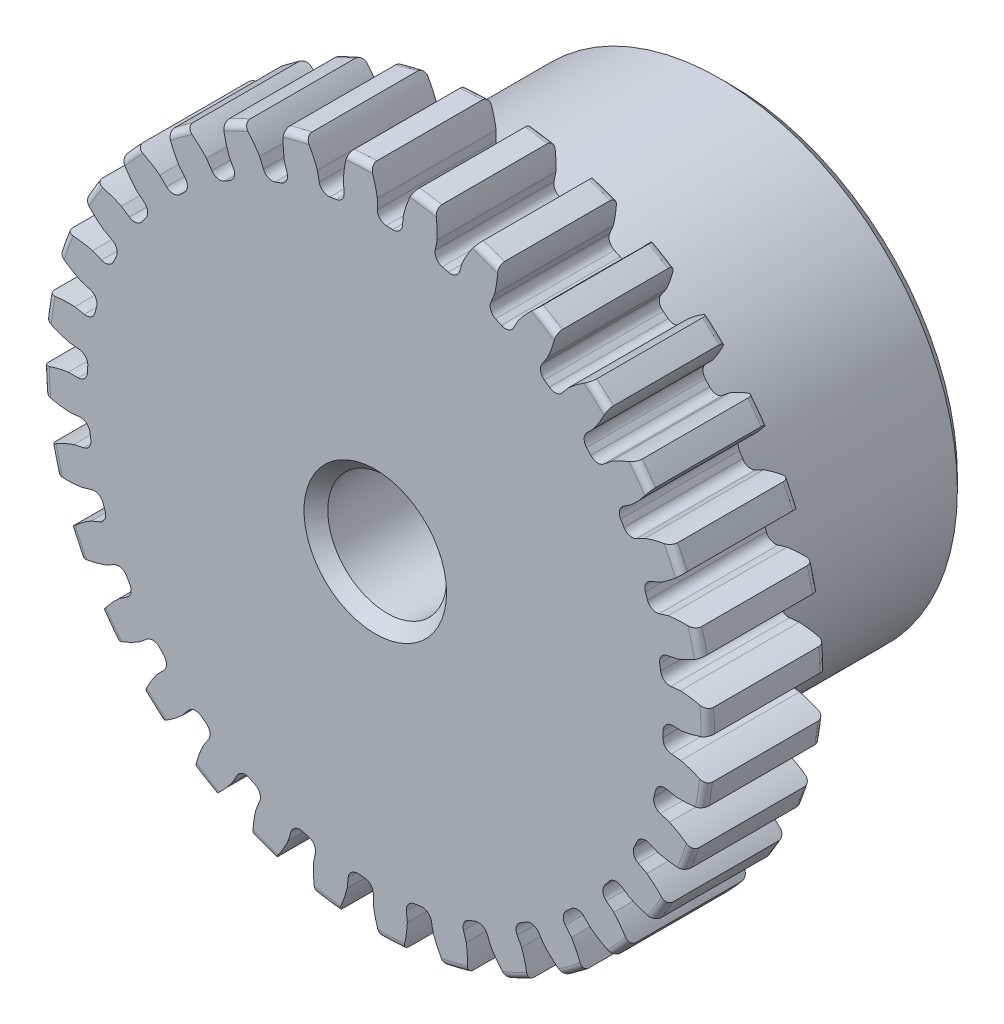
from build123d import *

# Parameters (mm, degrees)
SKETCH1_R                = 8.89
BOSS_EXTRUDE1_DEPTH      = 3.175
SKETCH2_W                = 6.35
SKETCH2_H                = 6.35
FILLET2_R                = 0.1778
CUT_EXTRUDE1_DEPTH       = 16.773072839
FILLET1_R                = 0.249489182
CIRPATTERN1_COUNT        = 32
FILLET1_OF_CIRPATTERN1_R = 0.249489182
SKETCH5_R                = 1.5875
CUT_EXTRUDE2_DEPTH       = 16.771905356
CHAMFER1_SIZE            = 0.3175


with BuildPart() as part:
    # Sketch1 → Boss-Extrude1 (new body)
    with BuildSketch(Plane.XY):
        Circle(SKETCH1_R)
    extrude(amount=-BOSS_EXTRUDE1_DEPTH)

    # Sketch2 → Revolve1 (revolve)
    with BuildSketch(Plane(origin=(0, 0, 0), x_dir=(0, 0, -1), z_dir=(1, 0, 0))):
        with Locations((6.35, 3.175)):
            Rectangle(SKETCH2_W, SKETCH2_H)
    revolve(axis=Axis((0, 0, -3.175), (0, 0, -1)))

    # Fillet2
    fillet2_edges = [part.edges().sort_by_distance(p)[0] for p in [
        (-8.89, 0, -3.175),
        (-8.89, 0, 0),
        (0, -6.35, -3.175),
    ]]
    fillet(fillet2_edges, radius=FILLET2_R)

    # Sketch4 → Cut-Extrude1 (cut, through all)
    with BuildSketch(Plane.XY):
        with BuildLine():
            Line((0.053138783, 8.200909689), (0.053138783, 7.698596297))
            ThreePointArc((0.053138783, 7.698596297), (0.377762097, 7.689506127), (0.701713249, 7.666733802))
            Line((0.701713249, 7.666733802), (0.750948686, 8.166628407))
            add(Edge.make_bspline(
                [(1.821754445, 9.820491389), (0.994167126, 9.128663497), (0.750948686, 8.166628407)],
                knots=[0, 0, 0, 1, 1, 1], degree=2))
            ThreePointArc((1.821754445, 9.820491389), (0.490090787, 9.976003779), (-0.850403432, 9.951766395))
            add(Edge.make_bspline(
                [(-0.850403432, 9.951766395), (-0.09461234, 9.182151928), (0.053138783, 8.200909689)],
                knots=[0, 0, 0, 1, 1, 1], degree=2))
        make_face()
    cut_extrude1 = extrude(amount=-CUT_EXTRUDE1_DEPTH, mode=Mode.SUBTRACT)

    # Fillet1
    fillet1_edges = [part.edges().sort_by_distance(p)[0] for p in [
        (0.701713249, 7.666733802, -1.5875),
        (0.053138783, 7.698596297, -1.5875),
    ]]
    fillet(fillet1_edges, radius=FILLET1_R)

    # CirPattern1: Cut-Extrude1 ×32 about axis
    cirpattern1_axis = Axis((0, 0, -3.175), (0, 0, 1))
    for i in range(1, CIRPATTERN1_COUNT):
        add(cut_extrude1.rotate(cirpattern1_axis, i * 360 / CIRPATTERN1_COUNT), mode=Mode.SUBTRACT)

    # Fillet1 of CirPattern1
    fillet1_of_cirpattern1_edges = [part.edges().sort_by_distance(p)[0] for p in [
        (-0.807475541, 7.656317126, -1.5875),
        (-1.449803895, 7.56103679, -1.5875),
        (-2.285633498, 7.351672476, -1.5875),
        (-2.897031422, 7.13291088, -1.5875),
        (-3.675955842, 6.764507175, -1.5875),
        (-4.232927656, 6.430671204, -1.5875),
        (-4.925013265, 5.917385658, -1.5875),
        (-5.406154854, 5.481304441, -1.5875),
        (-5.984805189, 4.842862328, -1.5875),
        (-6.371626553, 4.321294222, -1.5875),
        (-6.814604407, 3.582230515, -1.5875),
        (-7.092240216, 2.995219089, -1.5875),
        (-7.382522198, 2.183935592, -1.5875),
        (-7.540303066, 1.554039367, -1.5875),
        (-7.666733802, 0.701713249, -1.5875),
        (-7.698596297, 0.053138783, -1.5875),
        (-7.656317126, -0.807475541, -1.5875),
        (-7.56103679, -1.449803895, -1.5875),
        (-7.351672476, -2.285633498, -1.5875),
        (-7.13291088, -2.897031422, -1.5875),
        (-6.764507175, -3.675955842, -1.5875),
        (-6.430671204, -4.232927656, -1.5875),
        (-5.917385658, -4.925013265, -1.5875),
        (-5.481304441, -5.406154854, -1.5875),
        (-4.842862328, -5.984805189, -1.5875),
        (-4.321294222, -6.371626553, -1.5875),
        (-3.582230515, -6.814604407, -1.5875),
        (-2.995219089, -7.092240216, -1.5875),
        (-2.183935592, -7.382522198, -1.5875),
        (-1.554039367, -7.540303066, -1.5875),
        (-0.701713249, -7.666733802, -1.5875),
        (-0.053138783, -7.698596297, -1.5875),
        (0.807475541, -7.656317126, -1.5875),
        (1.449803895, -7.56103679, -1.5875),
        (2.285633498, -7.351672476, -1.5875),
        (2.897031422, -7.13291088, -1.5875),
        (3.675955842, -6.764507175, -1.5875),
        (4.232927656, -6.430671204, -1.5875),
        (4.925013265, -5.917385658, -1.5875),
        (5.406154854, -5.481304441, -1.5875),
        (5.984805189, -4.842862328, -1.5875),
        (6.371626553, -4.321294222, -1.5875),
        (6.814604407, -3.582230515, -1.5875),
        (7.092240216, -2.995219089, -1.5875),
        (7.382522198, -2.183935592, -1.5875),
        (7.540303066, -1.554039367, -1.5875),
        (7.666733802, -0.701713249, -1.5875),
        (7.698596297, -0.053138783, -1.5875),
        (7.656317126, 0.807475541, -1.5875),
        (7.56103679, 1.449803895, -1.5875),
        (7.351672476, 2.285633498, -1.5875),
        (7.13291088, 2.897031422, -1.5875),
        (6.764507175, 3.675955842, -1.5875),
        (6.430671204, 4.232927656, -1.5875),
        (5.917385658, 4.925013265, -1.5875),
        (5.481304441, 5.406154854, -1.5875),
        (4.842862328, 5.984805189, -1.5875),
        (4.321294222, 6.371626553, -1.5875),
        (3.582230515, 6.814604407, -1.5875),
        (2.995219089, 7.092240216, -1.5875),
        (2.183935592, 7.382522198, -1.5875),
        (1.554039367, 7.540303066, -1.5875),
    ]]
    fillet(fillet1_of_cirpattern1_edges, radius=FILLET1_OF_CIRPATTERN1_R)

    # Sketch5 → Cut-Extrude2 (cut, through all)
    with BuildSketch(Plane.XY):
        Circle(SKETCH5_R)
    extrude(amount=-CUT_EXTRUDE2_DEPTH, mode=Mode.SUBTRACT)

    # Chamfer1
    chamfer1_edges = [part.edges().sort_by_distance(p)[0] for p in [
        (0, -6.35, -9.525),
        (-1.5875, 0, 0),
        (-1.5875, 0, -9.525),
    ]]
    chamfer(chamfer1_edges, length=CHAMFER1_SIZE)


solid = part.part
